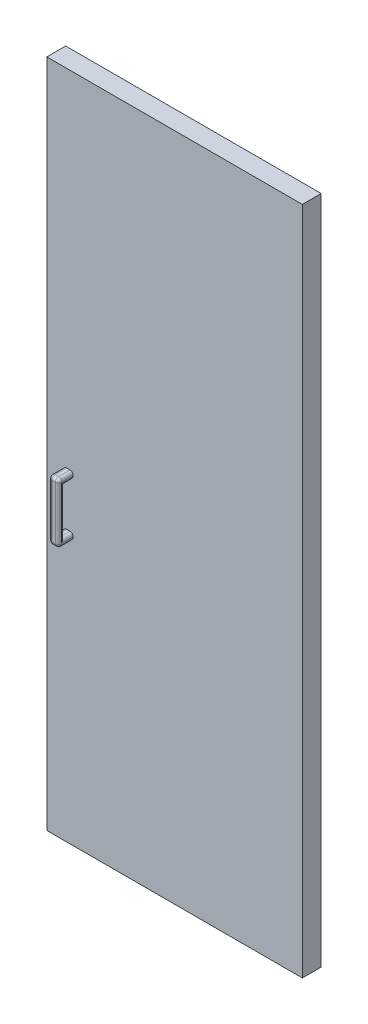
from build123d import *

# Parameters (mm, degrees)
BOSS_EXTRUDE2_DEPTH = 57.15
SKETCH4_W           = 30
SKETCH4_H           = 182
BOSS_EXTRUDE3_DEPTH = 44
SKETCH5_W           = 26
SKETCH5_H           = 140
CUT_EXTRUDE1_DEPTH  = 57.15
FILLET1_R           = 10
SKETCH6_W           = 120
SKETCH6_H           = 460
BOSS_EXTRUDE4_DEPTH = 10


with BuildPart() as part:
    # Sketch1 → Boss-Extrude2 (new body)
    with BuildSketch(Plane.XY):
        Polygon((0, 0), (0, 446.201837212), (-775, 446.201837212), (-775, -1585.798162788), (0, -1585.798162788), align=None)
    extrude(amount=BOSS_EXTRUDE2_DEPTH)

    # Sketch4 → Boss-Extrude3 (add)
    with BuildSketch(Plane.XY.offset(57.15)):
        with Locations((-710, -694.798162788)):
            Rectangle(SKETCH4_W, SKETCH4_H)
    extrude(amount=BOSS_EXTRUDE3_DEPTH)

    # Sketch5 → Cut-Extrude1 (cut)
    with BuildSketch(Plane.ZY.offset(725)):
        with Locations((70.15, -694.798162788)):
            Rectangle(SKETCH5_W, SKETCH5_H)
    extrude(amount=-CUT_EXTRUDE1_DEPTH, mode=Mode.SUBTRACT)

    # Fillet1
    # the kernel refuses this fillet: 10 mm, written as the material it takes off along each edge
    with BuildSketch(Plane(origin=(-715, -613.798162788, 91.15), x_dir=(-1, 0, 0), z_dir=(0, 1, 0))) as fillet1_piece_1_section:
        Polygon((0, 0), (FILLET1_R * 1.02, 0), (FILLET1_R * 1.02, FILLET1_R * 1.02), (0, FILLET1_R * 1.02), align=None)
    fillet1_piece_1 = extrude(amount=FILLET1_R * 1.02, mode=Mode.PRIVATE)
    fillet1_piece_1 = fillet1_piece_1 - Plane(origin=(-715, -613.798162788, 91.15), x_dir=(0.7071067811865475, 0, -0.7071067811865475), z_dir=(0, 1, 0)) * Sphere(FILLET1_R, mode=Mode.PRIVATE)
    add(fillet1_piece_1, mode=Mode.SUBTRACT)
    with BuildSketch(Plane(origin=(-715, -775.798162788, 91.15), x_dir=(0, 0, 1), z_dir=(-1, 0, 0))) as fillet1_piece_2_section:
        Polygon((0, 0), (FILLET1_R * 1.02, 0), (FILLET1_R * 1.02, -FILLET1_R * 1.02), (0, -FILLET1_R * 1.02), align=None)
    fillet1_piece_2 = extrude(amount=FILLET1_R * 1.02, mode=Mode.PRIVATE)
    fillet1_piece_2 = fillet1_piece_2 - Plane(origin=(-715, -775.798162788, 91.15), x_dir=(0, 0.7071067811865475, -0.7071067811865475), z_dir=(-1, 0, 0)) * Sphere(FILLET1_R, mode=Mode.PRIVATE)
    add(fillet1_piece_2, mode=Mode.SUBTRACT)
    with BuildSketch(Plane(origin=(-705, -775.798162788, 91.15), x_dir=(0, -1, 0), z_dir=(0, 0, 1))) as fillet1_piece_3_section:
        Polygon((0, 0), (FILLET1_R * 1.02, 0), (FILLET1_R * 1.02, FILLET1_R * 1.02), (0, FILLET1_R * 1.02), align=None)
    fillet1_piece_3 = extrude(amount=FILLET1_R * 1.02, mode=Mode.PRIVATE)
    fillet1_piece_3 = fillet1_piece_3 - Plane(origin=(-705, -775.798162788, 91.15), x_dir=(-0.7071067811865472, 0.7071067811865477, 0), z_dir=(0, 0, 1)) * Sphere(FILLET1_R, mode=Mode.PRIVATE)
    add(fillet1_piece_3, mode=Mode.SUBTRACT)
    with BuildSketch(Plane(origin=(-705, -613.798162788, 91.15), x_dir=(0, 0, 1), z_dir=(0, 1, 0))) as fillet1_piece_4_section:
        Polygon((0, 0), (FILLET1_R * 1.02, 0), (FILLET1_R * 1.02, FILLET1_R * 1.02), (0, FILLET1_R * 1.02), align=None)
    fillet1_piece_4 = extrude(amount=FILLET1_R * 1.02, mode=Mode.PRIVATE)
    fillet1_piece_4 = fillet1_piece_4 - Plane(origin=(-705, -613.798162788, 91.15), x_dir=(-0.7071067811865475, 0, -0.7071067811865475), z_dir=(0, 1, 0)) * Sphere(FILLET1_R, mode=Mode.PRIVATE)
    add(fillet1_piece_4, mode=Mode.SUBTRACT)
    with BuildSketch(Plane(origin=(-725, -603.798162788, 57.15), x_dir=(1, 0, 0), z_dir=(0, 0, 1)), Plane(origin=(-695, -785.798162788, 57.15), x_dir=(-1, 0, 0), z_dir=(0, 0, 1)), Plane(origin=(-695, -603.798162788, 57.15), x_dir=(0, -1, 0), z_dir=(0, 0, 1))) as fillet1_piece_5:
        with BuildLine():
            CenterArc((FILLET1_R, -FILLET1_R), FILLET1_R, 90, 90)
            Line((0, -FILLET1_R), (-FILLET1_R * 0.02, -FILLET1_R))
            Line((-FILLET1_R * 0.02, -FILLET1_R), (-FILLET1_R * 0.02, FILLET1_R * 0.02))
            Line((-FILLET1_R * 0.02, FILLET1_R * 0.02), (FILLET1_R, FILLET1_R * 0.02))
            Line((FILLET1_R, FILLET1_R * 0.02), (FILLET1_R, 0))
        make_face()
    extrude(amount=34, mode=Mode.SUBTRACT)
    with BuildSketch(Plane(origin=(-725, -785.798162788, 57.15), x_dir=(1, 0, 0), z_dir=(0, 0, 1))) as fillet1_piece_6:
        with BuildLine():
            CenterArc((FILLET1_R, FILLET1_R), FILLET1_R, 180, 90)
            Line((0, FILLET1_R), (-FILLET1_R * 0.02, FILLET1_R))
            Line((-FILLET1_R * 0.02, FILLET1_R), (-FILLET1_R * 0.02, -FILLET1_R * 0.02))
            Line((-FILLET1_R * 0.02, -FILLET1_R * 0.02), (FILLET1_R, -FILLET1_R * 0.02))
            Line((FILLET1_R, -FILLET1_R * 0.02), (FILLET1_R, 0))
        make_face()
    extrude(amount=34, mode=Mode.SUBTRACT)
    with BuildSketch(Plane(origin=(-725, -775.798162788, 101.15), x_dir=(0, 0, -1), z_dir=(0, 1, 0)), Plane(origin=(-695, -613.798162788, 101.15), x_dir=(0, 0, -1), z_dir=(0, -1, 0))) as fillet1_piece_7:
        with BuildLine():
            CenterArc((FILLET1_R, -FILLET1_R), FILLET1_R, 90, 90)
            Line((0, -FILLET1_R), (-FILLET1_R * 0.02, -FILLET1_R))
            Line((-FILLET1_R * 0.02, -FILLET1_R), (-FILLET1_R * 0.02, FILLET1_R * 0.02))
            Line((-FILLET1_R * 0.02, FILLET1_R * 0.02), (FILLET1_R, FILLET1_R * 0.02))
            Line((FILLET1_R, FILLET1_R * 0.02), (FILLET1_R, 0))
        make_face()
    extrude(amount=162, mode=Mode.SUBTRACT)
    with BuildSketch(Plane(origin=(-705, -785.798162788, 101.15), x_dir=(0, 0, -1), z_dir=(-1, 0, 0)), Plane(origin=(-715, -603.798162788, 101.15), x_dir=(0, 0, -1), z_dir=(1, 0, 0))) as fillet1_piece_8:
        with BuildLine():
            CenterArc((FILLET1_R, -FILLET1_R), FILLET1_R, 90, 90)
            Line((0, -FILLET1_R), (-FILLET1_R * 0.02, -FILLET1_R))
            Line((-FILLET1_R * 0.02, -FILLET1_R), (-FILLET1_R * 0.02, FILLET1_R * 0.02))
            Line((-FILLET1_R * 0.02, FILLET1_R * 0.02), (FILLET1_R, FILLET1_R * 0.02))
            Line((FILLET1_R, FILLET1_R * 0.02), (FILLET1_R, 0))
        make_face()
    extrude(amount=10, mode=Mode.SUBTRACT)
    with BuildSketch(Plane(origin=(-695, -764.798162788, 83.15), x_dir=(0, -1, 0), z_dir=(0, 0, -1)), Plane(origin=(-695, -624.798162788, 57.15), x_dir=(0, 1, 0), z_dir=(0, 0, 1)), Plane(origin=(-725, -764.798162788, 57.15), x_dir=(0, -1, 0), z_dir=(0, 0, 1)), Plane(origin=(-725, -624.798162788, 83.15), x_dir=(0, 1, 0), z_dir=(0, 0, -1))) as fillet1_piece_9:
        with BuildLine():
            CenterArc((FILLET1_R, FILLET1_R), FILLET1_R, 180, 90)
            Line((0, FILLET1_R), (-FILLET1_R * 0.02, FILLET1_R))
            Line((-FILLET1_R * 0.02, FILLET1_R), (-FILLET1_R * 0.02, -FILLET1_R * 0.02))
            Line((-FILLET1_R * 0.02, -FILLET1_R * 0.02), (FILLET1_R, -FILLET1_R * 0.02))
            Line((FILLET1_R, -FILLET1_R * 0.02), (FILLET1_R, 0))
        make_face()
    extrude(amount=26, mode=Mode.SUBTRACT)
    with BuildSketch(Plane(origin=(-695, -624.798162788, 83.15), x_dir=(0, 0, 1), z_dir=(0, -1, 0)), Plane(origin=(-725, -764.798162788, 83.15), x_dir=(0, 0, 1), z_dir=(0, 1, 0))) as fillet1_piece_10:
        with BuildLine():
            CenterArc((FILLET1_R, FILLET1_R), FILLET1_R, 180, 90)
            Line((0, FILLET1_R), (-FILLET1_R * 0.02, FILLET1_R))
            Line((-FILLET1_R * 0.02, FILLET1_R), (-FILLET1_R * 0.02, -FILLET1_R * 0.02))
            Line((-FILLET1_R * 0.02, -FILLET1_R * 0.02), (FILLET1_R, -FILLET1_R * 0.02))
            Line((FILLET1_R, -FILLET1_R * 0.02), (FILLET1_R, 0))
        make_face()
    extrude(amount=140, mode=Mode.SUBTRACT)
    with BuildSketch(Plane(origin=(-695, -624.798162788, 83.15), x_dir=(0, 0, 1), z_dir=(0, -1, 0))) as fillet1_piece_11a_section:
        with BuildLine():
            CenterArc((FILLET1_R, FILLET1_R), FILLET1_R, 180, 90)
            Line((0, FILLET1_R), (-FILLET1_R * 0.02, FILLET1_R))
            Line((-FILLET1_R * 0.02, FILLET1_R), (-FILLET1_R * 0.02, -FILLET1_R * 0.02))
            Line((-FILLET1_R * 0.02, -FILLET1_R * 0.02), (FILLET1_R, -FILLET1_R * 0.02))
            Line((FILLET1_R, -FILLET1_R * 0.02), (FILLET1_R, 0))
        make_face()
    fillet1_piece_11a = extrude(amount=165, mode=Mode.PRIVATE)
    fillet1_piece_11a = split(fillet1_piece_11a, bisect_by=Plane(origin=(-697.263951143, -764.798162788, 85.413951143), z_dir=(0, -1, 0)), keep=Keep.TOP, mode=Mode.PRIVATE)
    with BuildSketch(Plane(origin=(-695, -764.798162788, 108.15), x_dir=(0, -1, 0), z_dir=(0, 0, -1))) as fillet1_piece_11b_section:
        with BuildLine():
            CenterArc((FILLET1_R, FILLET1_R), FILLET1_R, 180, 90)
            Line((0, FILLET1_R), (-FILLET1_R * 0.02, FILLET1_R))
            Line((-FILLET1_R * 0.02, FILLET1_R), (-FILLET1_R * 0.02, -FILLET1_R * 0.02))
            Line((-FILLET1_R * 0.02, -FILLET1_R * 0.02), (FILLET1_R, -FILLET1_R * 0.02))
            Line((FILLET1_R, -FILLET1_R * 0.02), (FILLET1_R, 0))
        make_face()
    fillet1_piece_11b = extrude(amount=51, mode=Mode.PRIVATE)
    fillet1_piece_11b = split(fillet1_piece_11b, bisect_by=Plane(origin=(-697.263951143, -767.062113931, 83.15), z_dir=(0, 0, 1)), keep=Keep.TOP, mode=Mode.PRIVATE)
    fillet1_piece_11 = fillet1_piece_11a & fillet1_piece_11b
    add(fillet1_piece_11, mode=Mode.SUBTRACT)
    with BuildSketch(Plane(origin=(-695, -624.798162788, 57.15), x_dir=(0, 1, 0), z_dir=(0, 0, 1))) as fillet1_piece_12a_section:
        with BuildLine():
            CenterArc((FILLET1_R, FILLET1_R), FILLET1_R, 180, 90)
            Line((0, FILLET1_R), (-FILLET1_R * 0.02, FILLET1_R))
            Line((-FILLET1_R * 0.02, FILLET1_R), (-FILLET1_R * 0.02, -FILLET1_R * 0.02))
            Line((-FILLET1_R * 0.02, -FILLET1_R * 0.02), (FILLET1_R, -FILLET1_R * 0.02))
            Line((FILLET1_R, -FILLET1_R * 0.02), (FILLET1_R, 0))
        make_face()
    fillet1_piece_12a = extrude(amount=51, mode=Mode.PRIVATE)
    fillet1_piece_12a = split(fillet1_piece_12a, bisect_by=Plane(origin=(-697.263951143, -622.534211645, 83.15), z_dir=(0, 0, 1)), keep=Keep.TOP, mode=Mode.PRIVATE)
    with BuildSketch(Plane(origin=(-695, -599.798162788, 83.15), x_dir=(0, 0, 1), z_dir=(0, -1, 0))) as fillet1_piece_12b_section:
        with BuildLine():
            CenterArc((FILLET1_R, FILLET1_R), FILLET1_R, 180, 90)
            Line((0, FILLET1_R), (-FILLET1_R * 0.02, FILLET1_R))
            Line((-FILLET1_R * 0.02, FILLET1_R), (-FILLET1_R * 0.02, -FILLET1_R * 0.02))
            Line((-FILLET1_R * 0.02, -FILLET1_R * 0.02), (FILLET1_R, -FILLET1_R * 0.02))
            Line((FILLET1_R, -FILLET1_R * 0.02), (FILLET1_R, 0))
        make_face()
    fillet1_piece_12b = extrude(amount=165, mode=Mode.PRIVATE)
    fillet1_piece_12b = split(fillet1_piece_12b, bisect_by=Plane(origin=(-697.263951143, -624.798162788, 85.413951143), z_dir=(0, 1, 0)), keep=Keep.TOP, mode=Mode.PRIVATE)
    fillet1_piece_12 = fillet1_piece_12a & fillet1_piece_12b
    add(fillet1_piece_12, mode=Mode.SUBTRACT)
    with BuildSketch(Plane(origin=(-725, -764.798162788, 57.15), x_dir=(0, -1, 0), z_dir=(0, 0, 1))) as fillet1_piece_13a_section:
        with BuildLine():
            CenterArc((FILLET1_R, FILLET1_R), FILLET1_R, 180, 90)
            Line((0, FILLET1_R), (-FILLET1_R * 0.02, FILLET1_R))
            Line((-FILLET1_R * 0.02, FILLET1_R), (-FILLET1_R * 0.02, -FILLET1_R * 0.02))
            Line((-FILLET1_R * 0.02, -FILLET1_R * 0.02), (FILLET1_R, -FILLET1_R * 0.02))
            Line((FILLET1_R, -FILLET1_R * 0.02), (FILLET1_R, 0))
        make_face()
    fillet1_piece_13a = extrude(amount=51, mode=Mode.PRIVATE)
    fillet1_piece_13a = split(fillet1_piece_13a, bisect_by=Plane(origin=(-722.736048857, -767.062113931, 83.15), z_dir=(0, 0, 1)), keep=Keep.TOP, mode=Mode.PRIVATE)
    with BuildSketch(Plane(origin=(-725, -789.798162788, 83.15), x_dir=(0, 0, 1), z_dir=(0, 1, 0))) as fillet1_piece_13b_section:
        with BuildLine():
            CenterArc((FILLET1_R, FILLET1_R), FILLET1_R, 180, 90)
            Line((0, FILLET1_R), (-FILLET1_R * 0.02, FILLET1_R))
            Line((-FILLET1_R * 0.02, FILLET1_R), (-FILLET1_R * 0.02, -FILLET1_R * 0.02))
            Line((-FILLET1_R * 0.02, -FILLET1_R * 0.02), (FILLET1_R, -FILLET1_R * 0.02))
            Line((FILLET1_R, -FILLET1_R * 0.02), (FILLET1_R, 0))
        make_face()
    fillet1_piece_13b = extrude(amount=165, mode=Mode.PRIVATE)
    fillet1_piece_13b = split(fillet1_piece_13b, bisect_by=Plane(origin=(-722.736048857, -764.798162788, 85.413951143), z_dir=(0, -1, 0)), keep=Keep.TOP, mode=Mode.PRIVATE)
    fillet1_piece_13 = fillet1_piece_13a & fillet1_piece_13b
    add(fillet1_piece_13, mode=Mode.SUBTRACT)
    with BuildSketch(Plane(origin=(-725, -764.798162788, 83.15), x_dir=(0, 0, 1), z_dir=(0, 1, 0))) as fillet1_piece_14a_section:
        with BuildLine():
            CenterArc((FILLET1_R, FILLET1_R), FILLET1_R, 180, 90)
            Line((0, FILLET1_R), (-FILLET1_R * 0.02, FILLET1_R))
            Line((-FILLET1_R * 0.02, FILLET1_R), (-FILLET1_R * 0.02, -FILLET1_R * 0.02))
            Line((-FILLET1_R * 0.02, -FILLET1_R * 0.02), (FILLET1_R, -FILLET1_R * 0.02))
            Line((FILLET1_R, -FILLET1_R * 0.02), (FILLET1_R, 0))
        make_face()
    fillet1_piece_14a = extrude(amount=165, mode=Mode.PRIVATE)
    fillet1_piece_14a = split(fillet1_piece_14a, bisect_by=Plane(origin=(-722.736048857, -624.798162788, 85.413951143), z_dir=(0, 1, 0)), keep=Keep.TOP, mode=Mode.PRIVATE)
    with BuildSketch(Plane(origin=(-725, -624.798162788, 108.15), x_dir=(0, 1, 0), z_dir=(0, 0, -1))) as fillet1_piece_14b_section:
        with BuildLine():
            CenterArc((FILLET1_R, FILLET1_R), FILLET1_R, 180, 90)
            Line((0, FILLET1_R), (-FILLET1_R * 0.02, FILLET1_R))
            Line((-FILLET1_R * 0.02, FILLET1_R), (-FILLET1_R * 0.02, -FILLET1_R * 0.02))
            Line((-FILLET1_R * 0.02, -FILLET1_R * 0.02), (FILLET1_R, -FILLET1_R * 0.02))
            Line((FILLET1_R, -FILLET1_R * 0.02), (FILLET1_R, 0))
        make_face()
    fillet1_piece_14b = extrude(amount=51, mode=Mode.PRIVATE)
    fillet1_piece_14b = split(fillet1_piece_14b, bisect_by=Plane(origin=(-722.736048857, -622.534211645, 83.15), z_dir=(0, 0, 1)), keep=Keep.TOP, mode=Mode.PRIVATE)
    fillet1_piece_14 = fillet1_piece_14a & fillet1_piece_14b
    add(fillet1_piece_14, mode=Mode.SUBTRACT)

    # Sketch6 → Boss-Extrude4 (add)
    with BuildSketch(Plane(origin=(0, 0, 0), x_dir=(-1, 0, 0), z_dir=(0, 0, -1))):
        with Locations((690, -694.798162788)):
            Rectangle(SKETCH6_W, SKETCH6_H)
    extrude(amount=BOSS_EXTRUDE4_DEPTH)


solid = part.part
